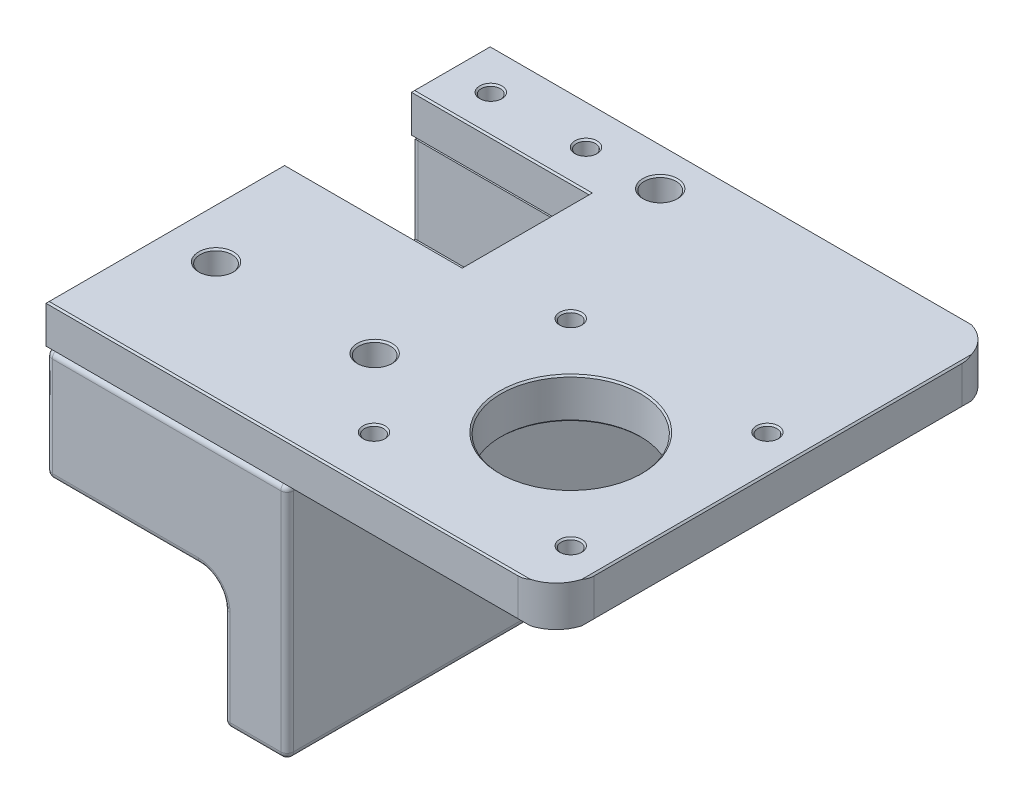
from build123d import *

# Parameters (mm, degrees)
BOSS_EXTRUDE1_DEPTH = 70
SKETCH4_R           = 1.5
SKETCH4_R_2         = 11
BOSS_EXTRUDE3_DEPTH = 6.35
SKETCH5_W           = 28
SKETCH5_H           = 20
CUT_EXTRUDE2_DEPTH  = 19.975
SKETCH2_R           = 1.5
CUT_EXTRUDE1_DEPTH  = 110.265550953
VARFILLET1_DEPTH    = 70
SKETCH7_R           = 3.25
CUT_EXTRUDE4_DEPTH  = 10
SKETCH8_R           = 2.5
CUT_EXTRUDE5_DEPTH  = 114.04778037
SKETCH18_R          = 2
CUT_EXTRUDE9_DEPTH  = 5
CHAMFER1_SIZE       = 0.25
FILLET1_R           = 1
FILLET2_R           = 6


with BuildPart() as part:
    # Sketch1 → Boss-Extrude1 (new body)
    with BuildSketch(Plane.XY):
        Polygon((0, 0), (0, 17.625), (38, 17.625), (38, -20), (28, -20), (28, 0), align=None)
    extrude(amount=BOSS_EXTRUDE1_DEPTH)

    # Sketch4 → Boss-Extrude3 (add)
    with BuildSketch(Plane(origin=(0, 17.625, 0), x_dir=(1, 0, 0), z_dir=(0, 1, 0))):
        Polygon((38, -70), (0, -70), (0, 0), (38, 0), (80.4, 0), (80.4, -70), align=None)
        with Locations(Location((43.7, -31, 0), (0, 0, 270))):
            Circle(SKETCH4_R, mode=Mode.SUBTRACT)
        with Locations(Location((43.7, -62, 0), (0, 0, 270))):
            Circle(SKETCH4_R, mode=Mode.SUBTRACT)
        with Locations(Location((74.7, -62, 0), (0, 0, 270))):
            Circle(SKETCH4_R, mode=Mode.SUBTRACT)
        with Locations(Location((74.7, -31, 0), (0, 0, 270))):
            Circle(SKETCH4_R, mode=Mode.SUBTRACT)
        with Locations(Location((59.2, -46.5, 0), (0, 0, 270))):
            Circle(SKETCH4_R_2, mode=Mode.SUBTRACT)
    extrude(amount=BOSS_EXTRUDE3_DEPTH)

    # Sketch5 → Cut-Extrude2 (cut)
    with BuildSketch(Plane(origin=(0, 23.975, 0), x_dir=(1, 0, 0), z_dir=(0, 1, 0))):
        with Locations((14, -22.4)):
            Rectangle(SKETCH5_W, SKETCH5_H)
    extrude(amount=-CUT_EXTRUDE2_DEPTH, mode=Mode.SUBTRACT)

    # Sketch2 → Cut-Extrude1 (cut, through all)
    with BuildSketch(Plane(origin=(0, 0, 0), x_dir=(1, 0, 0), z_dir=(0, 1, 0))):
        with Locations(Location((6.5, -6.4, 0), (0, 0, 270))):
            Circle(SKETCH2_R)
        with Locations(Location((6.5, -22.4, 0), (0, 0, 180))):
            Circle(SKETCH2_R)
        with Locations(Location((21.5, -22.4, 0), (0, 0, 180))):
            Circle(SKETCH2_R)
        with Locations(Location((21.5, -6.4, 0), (0, 0, 270))):
            Circle(SKETCH2_R)
    extrude(amount=CUT_EXTRUDE1_DEPTH, mode=Mode.SUBTRACT)

    # VarFillet1: read off the stored shape, not the designer's step
    # VarFillet1 outline → VarFillet1 (add)
    with BuildSketch(Plane.XY):
        with BuildLine():
            add(Edge.make_bspline(
                [(28, -4), (28, 0), (24, 0)],
                knots=[0, 0, 0, 1, 1, 1], degree=2, weights=[1, 0.707106781, 1]))
            Line((28, -4), (28, 0))
            Line((28, 0), (24, 0))
        make_face()
    extrude(amount=VARFILLET1_DEPTH)


with BuildPart() as body_2:
    # Split1: read off the stored shape, not the designer's step
    # Split1: the piece on the far side of the plane
    add(part.part)
    split(bisect_by=Plane(origin=(0, 17.625, 0), x_dir=(1, 0, 0), z_dir=(0, 1, 0)), keep=Keep.BOTTOM)

    # Sketch7 → Cut-Extrude4 (cut)
    with BuildSketch(Plane(origin=(0, 17.625, 0), x_dir=(1, 0, 0), z_dir=(0, 1, 0))):
        with Locations(Location((33, -6.2, 0), (0, 0, 270))):
            Circle(SKETCH7_R)
        with Locations(Location((33, -51.2, 0), (0, 0, 270))):
            Circle(SKETCH7_R)
        with Locations(Location((8, -51.2, 0), (0, 0, 270))):
            Circle(SKETCH7_R)
    extrude(amount=-CUT_EXTRUDE4_DEPTH, mode=Mode.SUBTRACT)

    # Sketch18 → Cut-Extrude9 (cut)
    with BuildSketch(Plane(origin=(52, -20, 0), x_dir=(0, 0, 1), z_dir=(0, 1, 0))):
        with Locations((35, -19)):
            Circle(SKETCH18_R)
    extrude(amount=CUT_EXTRUDE9_DEPTH, mode=Mode.SUBTRACT)

    # Fillet1
    fillet1_edges = [body_2.edges().sort_by_distance(p)[0] for p in [
        (0, 8.8125, 0),
        (0, 8.8125, 70),
        (19, 17.625, 70),
        (0, 17.625, 6.2),
        (0, 17.625, 51.2),
        (0, 0, 35),
        (38, -20, 35),
        (28, -20, 35),
        (19, 17.625, 0),
        (38, 17.625, 35),
        (33, -20, 70),
        (38, -1.1875, 70),
        (0, 10.8125, 32.4),
        (0, 10.8125, 12.4),
        (0, 4, 22.4),
        (12, 0, 70),
        (38, -1.1875, 0),
        (28, -12, 0),
        (28, -12, 70),
        (28, -4, 35),
        (24, 0, 35),
        (26.828426796, -1.171572546, 0),
        (33, -20, 0),
        (26.828426796, -1.171572546, 70),
        (12, 0, 0),
    ]]
    fillet(fillet1_edges, radius=FILLET1_R)


with BuildPart() as part_1:
    add(part.part)

    # Split1
    split(bisect_by=Plane(origin=(0, 17.625, 0), x_dir=(1, 0, 0), z_dir=(0, 1, 0)), keep=Keep.TOP)

    # Sketch8 → Cut-Extrude5 (cut, through all)
    with BuildSketch(Plane.XZ.offset(-17.625)):
        with Locations(Location((8, 51.2, 0), (0, 0, 270))):
            Circle(SKETCH8_R)
        with Locations(Location((33, 51.2, 0), (0, 0, 270))):
            Circle(SKETCH8_R)
        with Locations(Location((33, 6.2, 0), (0, 0, 270))):
            Circle(SKETCH8_R)
    extrude(amount=-CUT_EXTRUDE5_DEPTH, mode=Mode.SUBTRACT)

    # Chamfer1
    chamfer1_edges = [part_1.edges().sort_by_distance(p)[0] for p in [
        (21.5, 23.975, 4.9),
        (6.5, 23.975, 4.9),
        (14, 23.975, 32.4),
        (28, 23.975, 22.4),
        (14, 23.975, 12.4),
        (59.2, 17.625, 35.5),
        (59.2, 23.975, 35.5),
        (43.7, 17.625, 29.5),
        (43.7, 23.975, 29.5),
        (74.7, 17.625, 29.5),
        (74.7, 23.975, 29.5),
        (74.7, 17.625, 60.5),
        (74.7, 23.975, 60.5),
        (43.7, 17.625, 60.5),
        (43.7, 23.975, 60.5),
        (40.2, 17.625, 70),
        (80.4, 17.625, 35),
        (40.2, 17.625, 0),
        (0, 23.975, 51.2),
        (0, 23.975, 6.2),
        (40.2, 23.975, 70),
        (80.4, 23.975, 35),
        (40.2, 23.975, 0),
        (21.5, 17.625, 4.9),
        (6.5, 17.625, 4.9),
        (0, 17.625, 51.2),
        (0, 17.625, 6.2),
        (14, 17.625, 12.4),
        (28, 17.625, 22.4),
        (14, 17.625, 32.4),
        (8, 23.975, 53.7),
        (8, 17.625, 53.7),
        (33, 23.975, 53.7),
        (33, 17.625, 53.7),
        (33, 23.975, 8.7),
        (33, 17.625, 8.7),
    ]]
    chamfer(chamfer1_edges, length=CHAMFER1_SIZE)

    # Fillet2
    # the kernel refuses this fillet: 6 mm, written as the material it takes off along each edge
    with BuildSketch(Plane(origin=(80.4, 2.875, 70), x_dir=(0, 0, -1), z_dir=(0, 1, 0)), Plane(origin=(80.4, 2.875, 0), x_dir=(-1, 0, 0), z_dir=(0, 1, 0))) as fillet2_piece_1:
        with BuildLine():
            CenterArc((FILLET2_R, FILLET2_R), FILLET2_R, 180, 90)
            Line((0, FILLET2_R), (0, 0))
            Line((0, 0), (FILLET2_R, 0))
        make_face()
    extrude(amount=35.85, mode=Mode.SUBTRACT)


solid = Compound([body_2.part, part_1.part])
